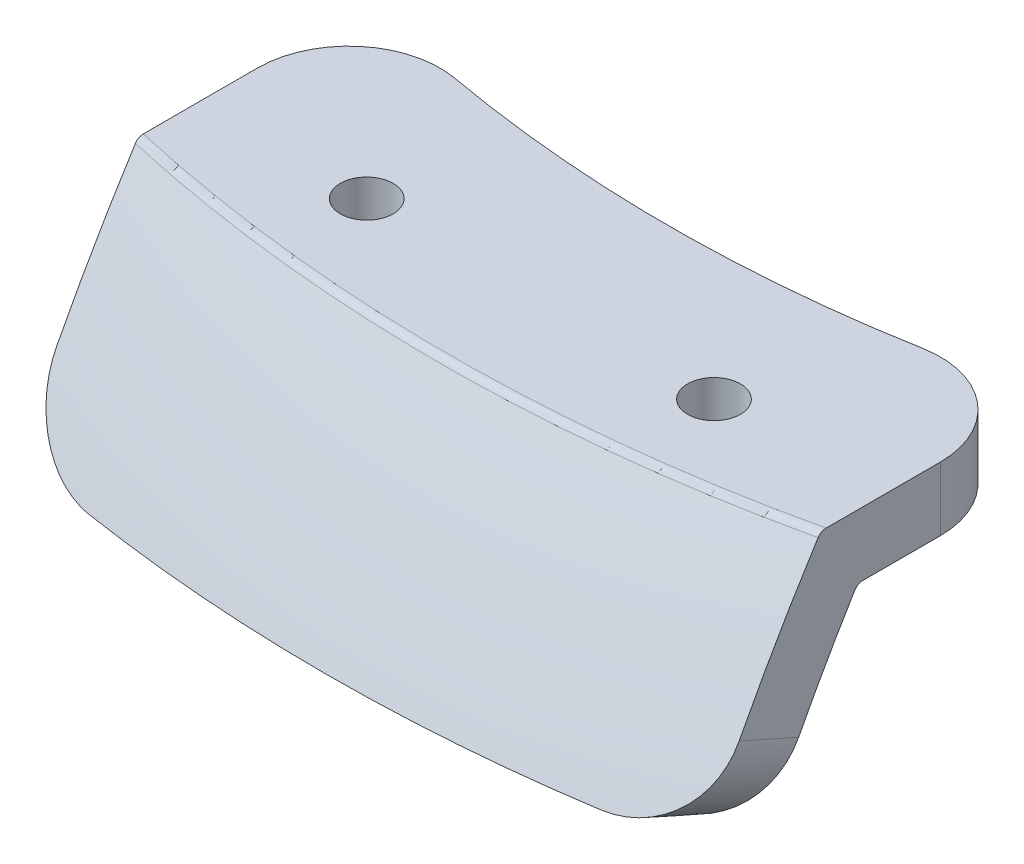
from build123d import *

# Parameters (mm, degrees)
REVOLVE1_ANGLE     = 30.000000000000068
SKETCH5_OUTSIDE_W  = 117.736
SKETCH5_OUTSIDE_H  = 65.89699999999999
CUT_EXTRUDE2_DEPTH = 274.2845636254711
FILLET1_R          = 10
FILLET2_R          = 1
SKETCH6_R          = 2.900000000000004
CUT_EXTRUDE3_DEPTH = 188.99913577306833


with BuildPart() as part:
    # Sketch1 → Revolve1 (revolve, symmetric)
    with BuildSketch(Plane(origin=(0, 0, 0), x_dir=(0, 0, -1), z_dir=(1, 0, 0))) as revolve1_sk:
        with BuildLine():
            Line((-182.28897358549048, 174.26497031601258), (-175.9096569245809, 171.3832487923671))
            ThreePointArc((-175.9096569245809, 171.3832487923671), (-171.0468196693478, 181.37164252085145), (-165.6174085762053, 191.06373675418266))
            Line((-165.6174085762053, 191.06373675418266), (-144.6984831785549, 191.06373675418266))
            Line((-144.6984831785549, 191.06373675418266), (-144.6984831785549, 198.06373675418266))
            Line((-144.6984831785549, 198.06373675418266), (-169.53896483649106, 198.06373675418266))
            ThreePointArc((-169.53896483649106, 198.06373675418266), (-176.31596605117772, 186.37972029550383), (-182.28897358549048, 174.26497031601258))
        make_face()
    revolve(axis=Axis((0, 0, 0), (0, 1, 3e-16)), revolution_arc=REVOLVE1_ANGLE / 2)
    revolve(revolve1_sk.sketch, axis=Axis((0, 0, 0), (0, -1, -3e-16)), revolution_arc=REVOLVE1_ANGLE / 2)

    # Sketch4 → Cut-Revolve1 (revolve, cut)
    with BuildSketch(Plane(origin=(0, 72.97443377482976, -37.182331170721355), x_dir=(0, 0.45399049973954475, 0.8910065241883689), z_dir=(0, -0.8910065241883689, 0.45399049973954475))):
        Polygon((219.74940650119794, 20.731311641719852), (239.0176946479082, 22.417068420107935), (239.1484282620297, 20.922776372970322), (219.88014011531945, 19.23701959458224), align=None)
    cut_revolve1 = revolve(axis=Axis((-19.23701959458224, 172.79792846858476, 158.73230821148098), (-0.08715574274765844, 0.4522629288245561, 0.887615975361608)), mode=Mode.SUBTRACT)

    # Mirror1: Cut-Revolve1 across plane
    add(cut_revolve1.mirror(Plane(origin=(0, 0, 0), x_dir=(0, 0, 1), z_dir=(1, 0, 0))), mode=Mode.SUBTRACT)

    # Sketch5 outside → Cut-Extrude2 (cut, through all)
    with BuildSketch(Plane(origin=(0, 0, 0), x_dir=(1, 0, 0), z_dir=(0, 1, 0))):
        with Locations((0, -161.0285)):
            Rectangle(SKETCH5_OUTSIDE_W, SKETCH5_OUTSIDE_H)
        Polygon((37.4507232440568, -139.76800192702046), (-37.45072324405682, -139.76800192702046), (-37.45072324405681, -182.28897358549045), (37.45072324405681, -182.28897358549045), align=None, mode=Mode.SUBTRACT)
    extrude(amount=CUT_EXTRUDE2_DEPTH, mode=Mode.SUBTRACT)

    # Fillet1
    fillet1_edges = [part.edges().sort_by_distance(p)[0] for p in [
        (-37.45072324405682, 194.56373675418266, 139.76800192702046),
        (37.45072324405682, 194.56373675418266, 139.76800192702046),
        (-37.45072324405681, 172.82361850192734, 175.1388554101279),
        (37.45072324405681, 172.82361850192734, 175.13885541012795),
    ]]
    fillet(fillet1_edges, radius=FILLET1_R)

    # Fillet2
    fillet2_edges = [part.edges().sort_by_distance(p)[0] for p in [
        (-7.11e-15, 198.06373675418266, 169.53896483649106),
        (0, 191.06373675418268, 165.61740857620535),
    ]]
    fillet(fillet2_edges, radius=FILLET2_R)

    # Sketch6 → Cut-Extrude3 (cut, through all)
    with BuildSketch(Plane(origin=(0, 198.0637367541827, 5.981e-14), x_dir=(1, 0, 0), z_dir=(0, 1, 0))):
        with Locations((19.049999999999898, -158.6742455715167)):
            Circle(SKETCH6_R)
        with Locations((-19.050000000000104, -158.6742455715167)):
            Circle(SKETCH6_R)
    extrude(amount=-CUT_EXTRUDE3_DEPTH, mode=Mode.SUBTRACT)


solid = part.part
